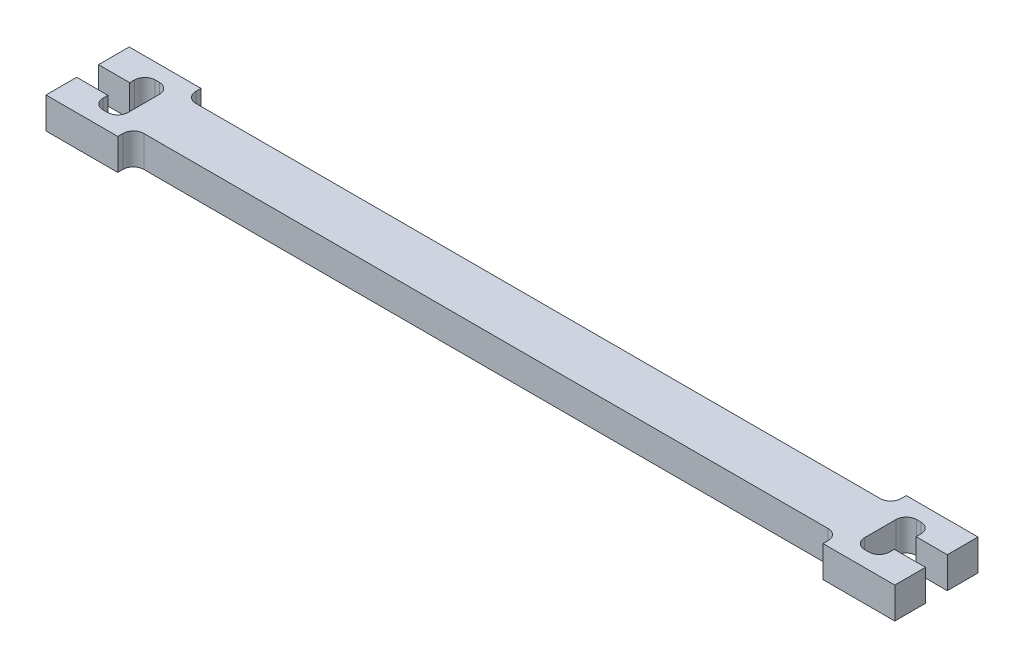
from build123d import *

# Parameters (mm, degrees)
BASE_SHAPE_DEPTH  = 3
MILLING_FILLETS_R = 1


with BuildPart() as part:
    # Sketch1 → Base shape (new body)
    with BuildSketch(Plane(origin=(0, 0, 0), x_dir=(1, 0, 0), z_dir=(0, 1, 0))):
        Polygon((-33.9, 4), (-40.8, 4), (-40.8, 1.05), (-37.8, 1.05), (-37.8, 2.5), (-35.4, 2.5), (-35.4, -2.5), (-37.8, -2.5), (-37.8, -1.05), (-40.8, -1.05), (-40.8, -4), (-33.9, -4), (-33.9, -2.5), (33.9, -2.5), (33.9, -4), (40.8, -4), (40.8, -1.05), (37.8, -1.05), (37.8, -2.5), (35.4, -2.5), (35.4, 2.5), (37.8, 2.5), (37.8, 1.05), (40.8, 1.05), (40.8, 4), (33.9, 4), (33.9, 2.5), (-33.9, 2.5), align=None)
    extrude(amount=BASE_SHAPE_DEPTH)

    # Milling fillets
    milling_fillets_edges = [part.edges().sort_by_distance(p)[0] for p in [
        (37.8, 1.5, 2.5),
        (-35.4, 1.5, 2.5),
        (-37.8, 1.5, 2.5),
        (35.4, 1.5, 2.5),
        (35.4, 1.5, -2.5),
        (-37.8, 1.5, -2.5),
        (-35.4, 1.5, -2.5),
        (37.8, 1.5, -2.5),
        (33.9, 1.5, 2.5),
        (33.9, 1.5, -2.5),
        (-33.9, 1.5, -2.5),
        (-33.9, 1.5, 2.5),
    ]]
    fillet(milling_fillets_edges, radius=MILLING_FILLETS_R)


solid = part.part
